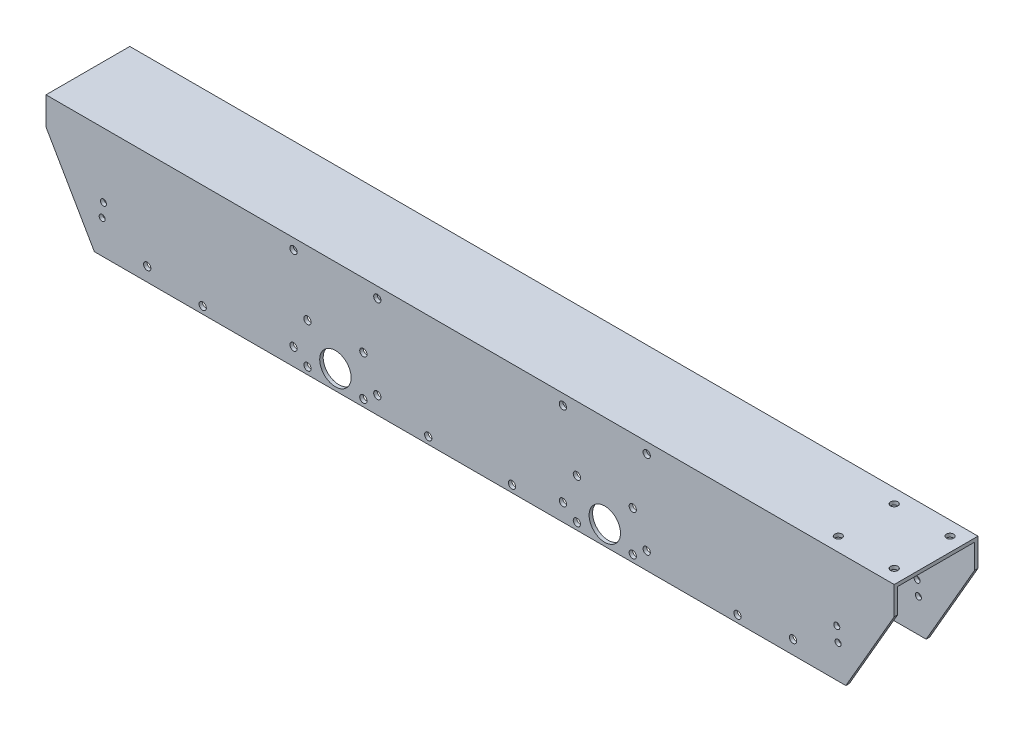
from build123d import *

# Parameters (mm, degrees)
BOSS_EXTRUDE1_DEPTH                     = 385.705756272
BEVELED_ENDS_DEPTH                      = 101.6
SKETCH2_R                               = 2.749999961
SKETCH2_R_2                             = 14.2875
SKETCH2_R_3                             = 2.75
SKETCH2_R_4                             = 3.302
AXLES_DEPTH                             = 141.732
FLANIGAN_MOUNTING_HOLES_R               = 3.3
FLANIGAN_MOUNTING_HOLES_EXTRUSION_DEPTH = 397.429073633
SKETCH32_R                              = 3.3
CUT_EXTRUDE21_DEPTH                     = 397.429073633
SKETCH33_R                              = 3.3
CUT_EXTRUDE22_DEPTH                     = 397.429073633
SKETCH36_R                              = 3.3
CUT_EXTRUDE25_DEPTH                     = 88.9
SKETCH37_R                              = 3.3
CUT_EXTRUDE26_DEPTH                     = 401.678300412


with BuildPart() as part:
    # Sketch1 → Boss-Extrude1 (new, symmetric)
    with BuildSketch(Plane(origin=(0, 0, 0), x_dir=(0, 0, -1), z_dir=(1, 0, 0))):
        Polygon((-38.1, 50.8), (38.1, 50.8), (38.1, -50.8), (34.925, -50.8), (34.925, 47.625), (-34.925, 47.625), (-34.925, -50.8), (-38.1, -50.8), align=None)
    extrude(amount=BOSS_EXTRUDE1_DEPTH, both=True)

    # Sketch16 → Beveled ends (cut)
    with BuildSketch(Plane.XY.offset(38.1)):
        Polygon((-385.705756272, 25.4), (-341.71166576, -50.8), (-385.705756272, -50.8), align=None)
        Polygon((341.71166576, -50.8), (385.705756272, -50.8), (385.705756272, 25.4), align=None)
    extrude(amount=-BEVELED_ENDS_DEPTH, mode=Mode.SUBTRACT)

    # Sketch2 → Axles (cut)
    with BuildSketch(Plane.XY.offset(38.1)):
        with Locations((-333.476515281, -7.874)):
            Circle(SKETCH2_R)
        with Locations((-122.5, -33.274)):
            Circle(SKETCH2_R_2)
        with Locations((334.620154629, -20.574)):
            Circle(SKETCH2_R_3)
        with Locations((333.476515281, -7.874)):
            Circle(SKETCH2_R)
        with Locations((84.4, -35.12)):
            Circle(SKETCH2_R_4)
        with Locations((84.4, 41.08)):
            Circle(SKETCH2_R_4)
        with Locations((122.5, -33.274)):
            Circle(SKETCH2_R_2)
        with Locations((-334.620154629, -20.574)):
            Circle(SKETCH2_R_3)
        with Locations((160.6, 41.08)):
            Circle(SKETCH2_R_4)
        with Locations((160.6, -35.12)):
            Circle(SKETCH2_R_4)
    axles = extrude(amount=-AXLES_DEPTH, mode=Mode.SUBTRACT)

    # Flanigan mounting holes → Flanigan mounting holes extrusion (cut, through all)
    with BuildSketch(Plane.XY.offset(38.1)):
        with Locations((-147.9, -7.87)):
            Circle(FLANIGAN_MOUNTING_HOLES_R)
        with Locations((-147.9, -44.45)):
            Circle(FLANIGAN_MOUNTING_HOLES_R)
        with Locations((-97.1, -7.874)):
            Circle(FLANIGAN_MOUNTING_HOLES_R)
        with Locations((-97.1, -44.45)):
            Circle(FLANIGAN_MOUNTING_HOLES_R)
    extrude(amount=-FLANIGAN_MOUNTING_HOLES_EXTRUSION_DEPTH, mode=Mode.SUBTRACT)

    # Sketch32 → Cut-Extrude21 (cut, through all)
    with BuildSketch(Plane(origin=(0, 0, -38.1), x_dir=(-1, 0, 0), z_dir=(0, 0, -1))):
        with Locations((-38.1, -44.45)):
            Circle(SKETCH32_R)
        with Locations((-147.9, -44.45)):
            Circle(SKETCH32_R)
        with Locations((-147.9, -7.87)):
            Circle(SKETCH32_R)
        with Locations((-97.1, -7.87)):
            Circle(SKETCH32_R)
        with Locations((-97.1, -44.45)):
            Circle(SKETCH32_R)
    cut_extrude21 = extrude(amount=-CUT_EXTRUDE21_DEPTH, mode=Mode.SUBTRACT)

    # Sketch33 → Cut-Extrude22 (cut, through all)
    with BuildSketch(Plane(origin=(0, 0, -38.1), x_dir=(-1, 0, 0), z_dir=(0, 0, -1))):
        with Locations((38.1, -44.45)):
            Circle(SKETCH33_R)
    extrude(amount=-CUT_EXTRUDE22_DEPTH, mode=Mode.SUBTRACT)

    # Sketch36 → Cut-Extrude25 (cut, symmetric)
    with BuildSketch(Plane(origin=(0, 0, -38.1), x_dir=(-1, 0, 0), z_dir=(0, 0, -1))):
        with Locations((-243.208603529, -44.325)):
            Circle(SKETCH36_R)
        with Locations((-293.644401064, -38.252905882)):
            Circle(SKETCH36_R)
    cut_extrude25 = extrude(amount=CUT_EXTRUDE25_DEPTH, both=True, mode=Mode.SUBTRACT)

    # Mirror3: Axles, Cut-Extrude21, Cut-Extrude25 across plane
    add(axles.mirror(Plane(origin=(0, 0, 0), x_dir=(0, 0, 1), z_dir=(1, 0, 0))), mode=Mode.SUBTRACT)
    add(cut_extrude21.mirror(Plane(origin=(0, 0, 0), x_dir=(0, 0, 1), z_dir=(1, 0, 0))), mode=Mode.SUBTRACT)
    add(cut_extrude25.mirror(Plane(origin=(0, 0, 0), x_dir=(0, 0, 1), z_dir=(1, 0, 0))), mode=Mode.SUBTRACT)

    # Sketch37 → Cut-Extrude26 (cut, through all)
    with BuildSketch(Plane(origin=(0, 50.8, 0), x_dir=(1, 0, 0), z_dir=(0, 1, 0))):
        with Locations((373.005756272, 25.4)):
            Circle(SKETCH37_R)
        with Locations((373.005756272, -25.4)):
            Circle(SKETCH37_R)
        with Locations((322.205756272, 25.4)):
            Circle(SKETCH37_R)
        with Locations((322.205756272, -25.4)):
            Circle(SKETCH37_R)
    extrude(amount=-CUT_EXTRUDE26_DEPTH, mode=Mode.SUBTRACT)


solid = part.part
